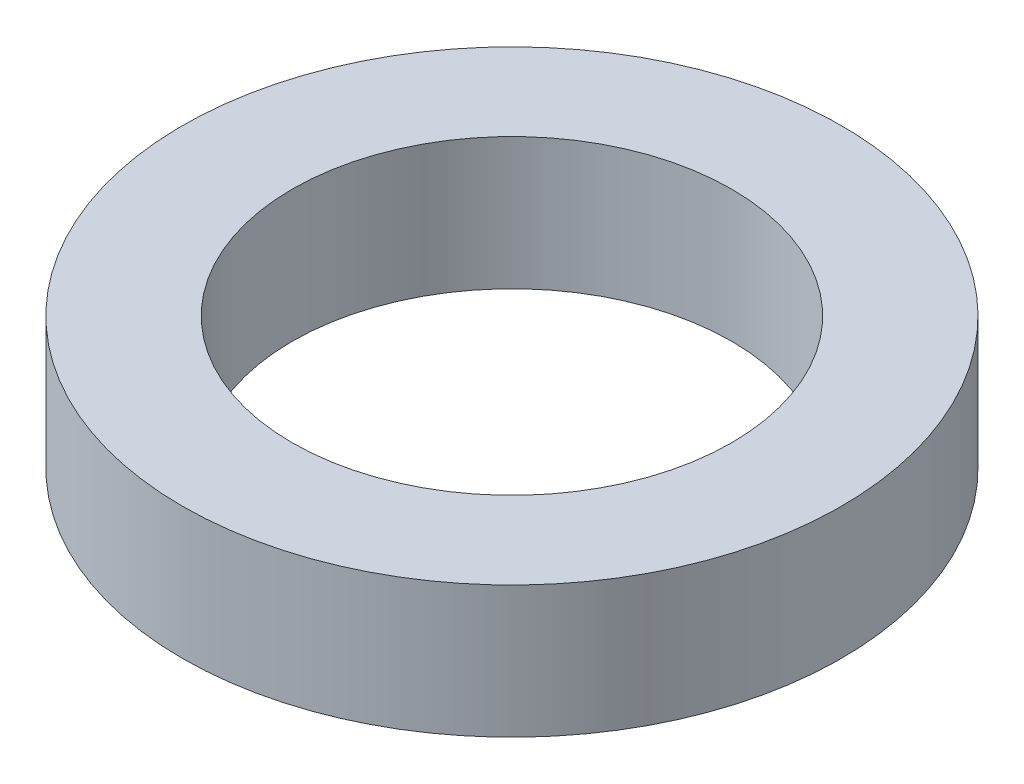
from build123d import *

# Parameters (mm, degrees)
SKETCH1_R           = 75
BOSS_EXTRUDE1_DEPTH = 30
SKETCH2_R           = 50
CUT_EXTRUDE1_DEPTH  = 111.227038425


with BuildPart() as part:
    # Sketch1 → Boss-Extrude1 (new body)
    with BuildSketch(Plane(origin=(0, 0, 0), x_dir=(1, 0, 0), z_dir=(0, 1, 0))):
        Circle(SKETCH1_R)
    extrude(amount=BOSS_EXTRUDE1_DEPTH)

    # Sketch2 → Cut-Extrude1 (cut, through all)
    with BuildSketch(Plane(origin=(0, 0, 0), x_dir=(1, 0, 0), z_dir=(0, 1, 0))):
        Circle(SKETCH2_R)
    extrude(amount=CUT_EXTRUDE1_DEPTH, mode=Mode.SUBTRACT)


solid = part.part
